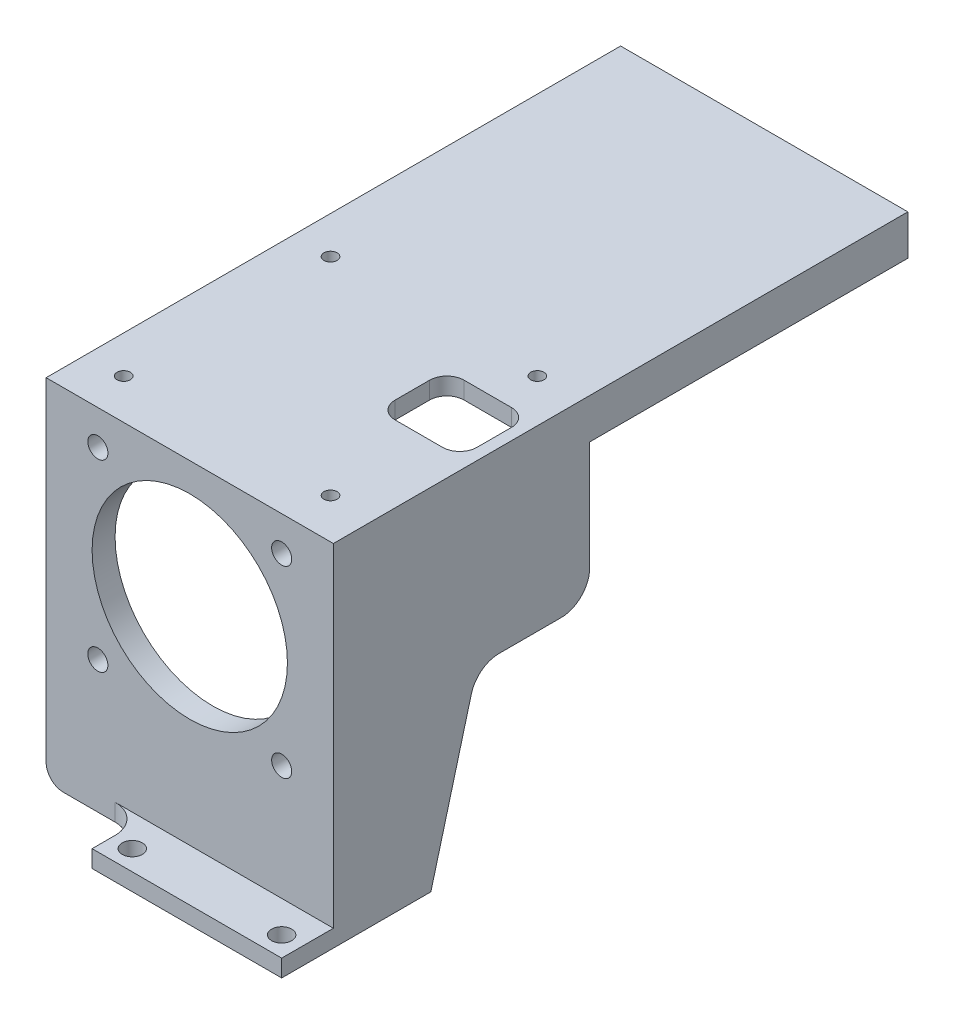
from build123d import *

# Parameters (mm, degrees)
SKETCH_1_W          = 33
SKETCH_1_H          = 10
EXTRUDE_1_DEPTH     = 3
HOLE_WIZARD_1_D     = 3.5
SKETCH_5_W          = 33
SKETCH_5_H          = 3
EXTRUDE_2_DEPTH     = 3
SKETCH_6_W          = 33
SKETCH_6_H          = 4
EXTRUDE_3_DEPTH     = 55
SKETCH_7_W          = 50
SKETCH_7_H          = 4
EXTRUDE_4_DEPTH     = 3
SKETCH_8_W          = 50
SKETCH_8_H          = 3
EXTRUDE_5_DEPTH     = 56
EXTRUDE_6_DEPTH     = 5
EXTRUDE_7_DEPTH     = 4
SKETCH_20_W         = 50
SKETCH_20_H         = 3
EXTRUDE_9_DEPTH     = 40
EXTRUDE_15_DEPTH    = 4
EXTRUDE_16_DEPTH    = 4
FILLET_1_R          = 3
HOLE_WIZARD_5_D     = 3.5
HOLE_WIZARD_6_D     = 34
HOLE_WIZARD_7_D     = 2.3
EXTRUDE_17_DEPTH    = 5
SKETCH_49_W         = 44.612037216
SKETCH_49_H         = 28
EXTRUDE_18_DEPTH    = 5
SKETCH_50_W         = 11.25
SKETCH_50_H         = 12
CUT_EXTRUDE_1_DEPTH = 10
EXTRUDE_19_DEPTH    = 5
FILLET_2_R          = 5
SKETCH_52_W         = 3
SKETCH_52_H         = 12
CUT_EXTRUDE_2_DEPTH = 126.136925006
FILLET_3_R          = 3
FILLET_4_R          = 5
SKETCH_53_W         = 5
SKETCH_53_H         = 55.387962784
SKETCH_53_H_2       = 45
EXTRUDE_20_DEPTH    = 4


with BuildPart() as part:
    # 草图1 → 凸台-拉伸1 (new body)
    with BuildSketch(Plane(origin=(0, 0, 0), x_dir=(1, 0, 0), z_dir=(0, 1, 0))):
        Rectangle(SKETCH_1_W, SKETCH_1_H)
    extrude(amount=EXTRUDE_1_DEPTH)

    # 孔1 (through all)
    with Locations(Plane(origin=(0, 3, 0), x_dir=(1, 0, 0), z_dir=(0, 1, 0))):
        with Locations((-13, -1.5), (13, -1.5)):
            Hole(HOLE_WIZARD_1_D / 2)

    # 草图5 → 凸台-拉伸2 (add)
    with BuildSketch(Plane.XZ):
        with Locations((0, -6.5)):
            Rectangle(SKETCH_5_W, SKETCH_5_H)
    extrude(amount=-EXTRUDE_2_DEPTH)

    # 草图6 → 凸台-拉伸3 (add)
    with BuildSketch(Plane(origin=(0, 3, 0), x_dir=(1, 0, 0), z_dir=(0, 1, 0))):
        with Locations((0, 6)):
            Rectangle(SKETCH_6_W, SKETCH_6_H)
    extrude(amount=EXTRUDE_3_DEPTH)

    # 草图7 → 凸台-拉伸4 (add)
    with BuildSketch(Plane(origin=(0, 58, 0), x_dir=(1, 0, 0), z_dir=(0, 1, 0))):
        with Locations((-8.5, 6)):
            Rectangle(SKETCH_7_W, SKETCH_7_H)
    extrude(amount=EXTRUDE_4_DEPTH)

    # 草图8 → 凸台-拉伸5 (add)
    with BuildSketch(Plane(origin=(0, 0, -8), x_dir=(-1, 0, 0), z_dir=(0, 0, -1))):
        with Locations((8.5, 59.5)):
            Rectangle(SKETCH_8_W, SKETCH_8_H)
    extrude(amount=EXTRUDE_5_DEPTH)

    # 草图15 → 凸台-拉伸6 (add)
    with BuildSketch(Plane(origin=(16.5, 0, 0), x_dir=(0, 0, -1), z_dir=(1, 0, 0))):
        Polygon((8, 0), (48.612037216, 58), (42.508164272, 58), (8, 8.717233978), align=None)
    extrude(amount=-EXTRUDE_6_DEPTH)

    # 草图16 → 凸台-拉伸7 (add)
    with BuildSketch(Plane.XY.offset(-4)):
        Polygon((-16.5, 0), (-33.5, 58), (-28.289650608, 58), (-16.5, 17.77648616), align=None)
    extrude(amount=-EXTRUDE_7_DEPTH)

    # 草图20 → 凸台-拉伸9 (add)
    with BuildSketch(Plane(origin=(0, 0, -64), x_dir=(-1, 0, 0), z_dir=(0, 0, -1))):
        with Locations((8.5, 59.5)):
            Rectangle(SKETCH_20_W, SKETCH_20_H)
    extrude(amount=EXTRUDE_9_DEPTH)

    # 草图33 → 凸台-拉伸15 (add)
    with BuildSketch(Plane.XY.offset(-4)):
        Polygon((-28.289650608, 58), (-16.5, 17.77648616), (-16.5, 58), align=None)
    extrude(amount=-EXTRUDE_15_DEPTH)

    # 草图34 → 凸台-拉伸16 (add)
    with BuildSketch(Plane.XY.offset(-4)):
        Polygon((-33.5, 58), (-33.5, 0), (-16.5, 0), align=None)
    extrude(amount=-EXTRUDE_16_DEPTH)

    # 圆角1
    fillet_1_edges = [part.edges().sort_by_distance(p)[0] for p in [
        (-33.5, 0, -6),
    ]]
    fillet(fillet_1_edges, radius=FILLET_1_R)

    # 孔5 (through all)
    with Locations(Plane.XY.offset(-4)):
        with Locations((-24.5, 55), (-24.5, 23), (7.5, 23), (7.5, 55)):
            Hole(HOLE_WIZARD_5_D / 2)

    # 孔6 (through all)
    with Locations(Plane.XY.offset(-4)):
        with Locations((-8.5, 39)):
            Hole(HOLE_WIZARD_6_D / 2)

    # 孔7 (through all)
    with Locations(Plane(origin=(0, 58, 0), x_dir=(-1, 0, 0), z_dir=(0, -1, 0))):
        with Locations((-9, 11), (-9, 47), (27, 47), (27, 11)):
            Hole(HOLE_WIZARD_7_D / 2)

    # 草图48 → 凸台-拉伸17 (add)
    with BuildSketch(Plane(origin=(16.5, 0, 0), x_dir=(0, 0, -1), z_dir=(1, 0, 0))):
        Polygon((8, 8.717233978), (8, 58), (42.508164272, 58), align=None)
    extrude(amount=-EXTRUDE_17_DEPTH)

    # 草图49 → 凸台-拉伸18 (add)
    with BuildSketch(Plane(origin=(16.5, 0, 0), x_dir=(0, 0, -1), z_dir=(1, 0, 0))):
        with Locations((26.306018608, 44)):
            Rectangle(SKETCH_49_W, SKETCH_49_H)
    extrude(amount=-EXTRUDE_18_DEPTH)

    # 草图50 → 切除-拉伸1 (cut)
    with BuildSketch(Plane(origin=(0, 61, 0), x_dir=(1, 0, 0), z_dir=(0, 1, 0))):
        with Locations((5.875, 34)):
            Rectangle(SKETCH_50_W, SKETCH_50_H)
    extrude(amount=-CUT_EXTRUDE_1_DEPTH, mode=Mode.SUBTRACT)

    # 草图51 → 凸台-拉伸19 (add)
    with BuildSketch(Plane(origin=(16.5, 0, 0), x_dir=(0, 0, -1), z_dir=(1, 0, 0))):
        Polygon((29.006226146, 30), (20.967750373, 0), (8, 0), align=None)
    extrude(amount=-EXTRUDE_19_DEPTH)

    # 圆角2
    fillet_2_edges = [part.edges().sort_by_distance(p)[0] for p in [
        (14, 30, -29.006226146),
        (14, 30, -48.612037216),
    ]]
    fillet(fillet_2_edges, radius=FILLET_2_R)

    # 草图52 → 切除-拉伸2 (cut, through all)
    with BuildSketch(Plane(origin=(0, 61, 0), x_dir=(1, 0, 0), z_dir=(0, 1, 0))):
        with Locations((13, 34)):
            Rectangle(SKETCH_52_W, SKETCH_52_H)
    extrude(amount=-CUT_EXTRUDE_2_DEPTH, mode=Mode.SUBTRACT)

    # 圆角3
    fillet_3_edges = [part.edges().sort_by_distance(p)[0] for p in [
        (0.25, 59.5, -28),
        (0.25, 59.5, -40),
        (14.5, 45.5, -40),
        (14.5, 43.622356449, -28),
    ]]
    fillet(fillet_3_edges, radius=FILLET_3_R - 0.0001)  # a hair under: the kernel refuses the full size

    # 圆角4
    fillet_4_edges = [part.edges().sort_by_distance(p)[0] for p in [
        (-16.5, 1.5, -4),
    ]]
    fillet(fillet_4_edges, radius=FILLET_4_R)

    # 草图53 → 凸台-拉伸20 (add)
    with BuildSketch(Plane.XZ.offset(-58)):
        with Locations((14, -76.306018608)):
            Rectangle(SKETCH_53_W, SKETCH_53_H)
        with Locations((-31, -81.5)):
            Rectangle(SKETCH_53_W, SKETCH_53_H_2)
    extrude(amount=EXTRUDE_20_DEPTH)


solid = part.part
